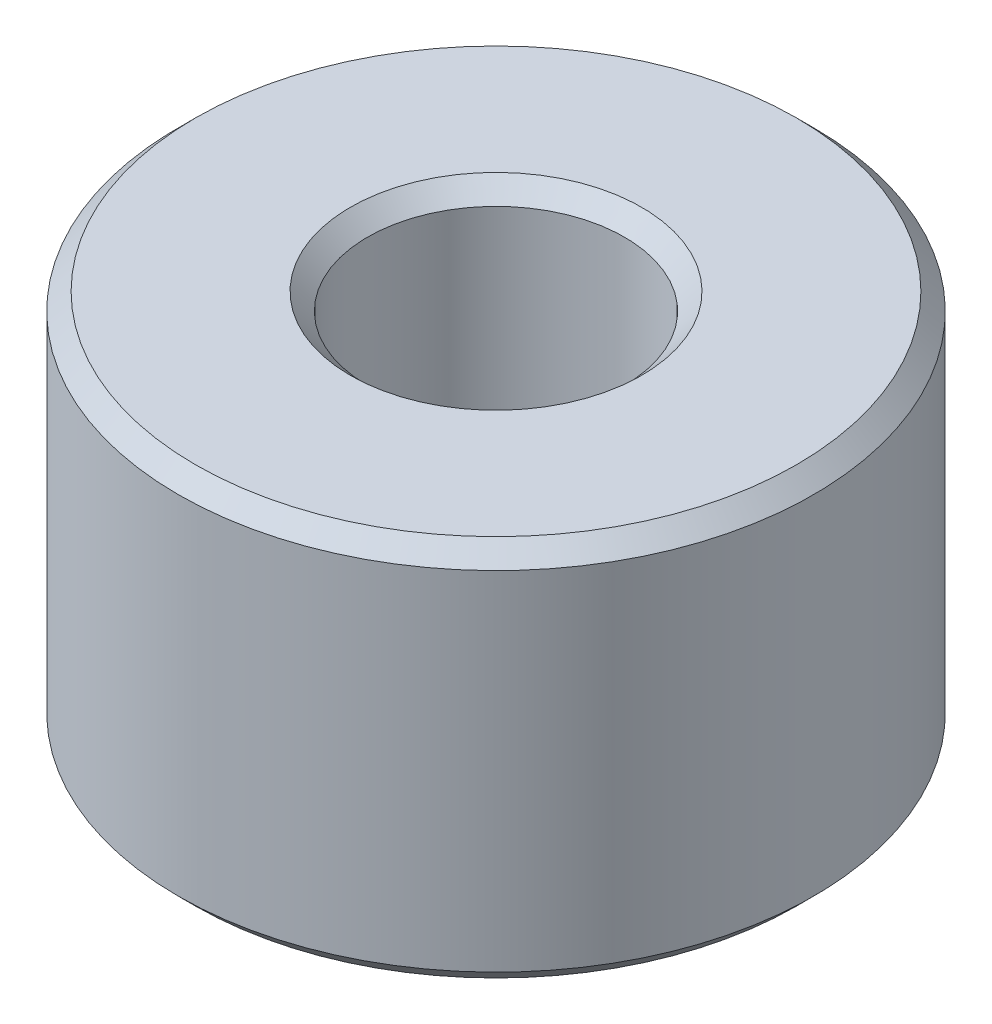
from build123d import *

# Parameters (mm, degrees)
SKETCH1_R           = 55
BOSS_EXTRUDE1_DEPTH = 66.169934735
SKETCH2_R           = 22.238179468
CUT_EXTRUDE1_DEPTH  = 103.119832858
CHAMFER1_SIZE       = 2.98123639


with BuildPart() as part:
    # Sketch1 → Boss-Extrude1 (new body)
    with BuildSketch(Plane(origin=(0, 0, 0), x_dir=(1, 0, 0), z_dir=(0, 1, 0))):
        Circle(SKETCH1_R)
    extrude(amount=BOSS_EXTRUDE1_DEPTH)

    # Sketch2 → Cut-Extrude1 (cut, through all)
    with BuildSketch(Plane(origin=(0, 0, 0), x_dir=(1, 0, 0), z_dir=(0, 1, 0))):
        Circle(SKETCH2_R)
    extrude(amount=CUT_EXTRUDE1_DEPTH, mode=Mode.SUBTRACT)

    # Chamfer1
    chamfer1_edges = [part.edges().sort_by_distance(p)[0] for p in [
        (-22.238179468, 66.169934735, 0),
        (-22.238179468, 0, 0),
        (-55, 0, 0),
        (-55, 66.169934735, 0),
    ]]
    chamfer(chamfer1_edges, length=CHAMFER1_SIZE)


solid = part.part
